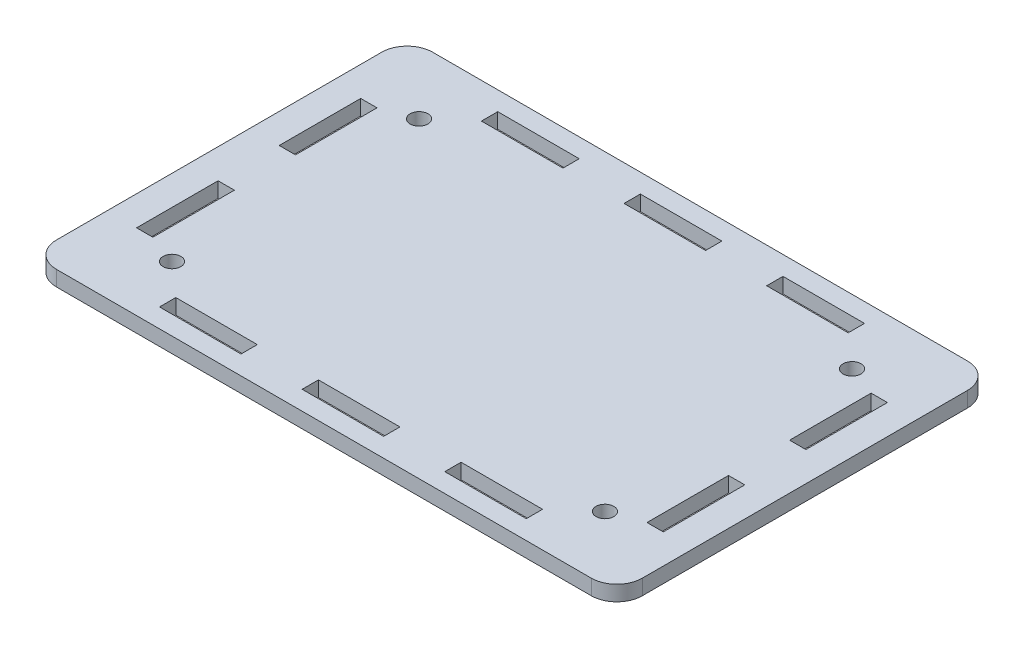
from build123d import *

# Parameters (mm, degrees)
SKETCH1_W           = 115
SKETCH1_H           = 73.849129594
SKETCH1_R           = 1.75
SKETCH1_W_2         = 16
SKETCH1_H_2         = 3.2
SKETCH1_W_3         = 3.2
SKETCH1_H_3         = 16
BOSS_EXTRUDE1_DEPTH = 3
FILLET1_R           = 5


with BuildPart() as part:
    # Sketch1 → Boss-Extrude1 (new body)
    with BuildSketch(Plane(origin=(0, 0, 0), x_dir=(1, 0, 0), z_dir=(0, 1, 0))):
        Rectangle(SKETCH1_W, SKETCH1_H)
        with Locations((-42.5, 24.25)):
            Circle(SKETCH1_R, mode=Mode.SUBTRACT)
        with Locations((42.5, 24.25)):
            Circle(SKETCH1_R, mode=Mode.SUBTRACT)
        with Locations((-42.5, -24.25)):
            Circle(SKETCH1_R, mode=Mode.SUBTRACT)
        with Locations((42.5, -24.25)):
            Circle(SKETCH1_R, mode=Mode.SUBTRACT)
        with Locations((-28, 31.6)):
            Rectangle(SKETCH1_W_2, SKETCH1_H_2, mode=Mode.SUBTRACT)
        with Locations((28, 31.6)):
            Rectangle(SKETCH1_W_2, SKETCH1_H_2, mode=Mode.SUBTRACT)
        with Locations((-50.1, 14)):
            Rectangle(SKETCH1_W_3, SKETCH1_H_3, mode=Mode.SUBTRACT)
        with Locations((-50.1, -14)):
            Rectangle(SKETCH1_W_3, SKETCH1_H_3, mode=Mode.SUBTRACT)
        with Locations((0, 31.6)):
            Rectangle(SKETCH1_W_2, SKETCH1_H_2, mode=Mode.SUBTRACT)
        with Locations((-28, -31.6)):
            Rectangle(SKETCH1_W_2, SKETCH1_H_2, mode=Mode.SUBTRACT)
        with Locations((28, -31.6)):
            Rectangle(SKETCH1_W_2, SKETCH1_H_2, mode=Mode.SUBTRACT)
        with Locations((0, -31.6)):
            Rectangle(SKETCH1_W_2, SKETCH1_H_2, mode=Mode.SUBTRACT)
        with Locations((50.1, -14)):
            Rectangle(SKETCH1_W_3, SKETCH1_H_3, mode=Mode.SUBTRACT)
        with Locations((50.1, 14)):
            Rectangle(SKETCH1_W_3, SKETCH1_H_3, mode=Mode.SUBTRACT)
    extrude(amount=BOSS_EXTRUDE1_DEPTH)

    # Fillet1
    fillet1_edges = [part.edges().sort_by_distance(p)[0] for p in [
        (-57.5, 1.5, -36.924564797),
        (57.5, 1.5, -36.924564797),
        (57.5, 1.5, 36.924564797),
        (-57.5, 1.5, 36.924564797),
    ]]
    fillet(fillet1_edges, radius=FILLET1_R)


solid = part.part
